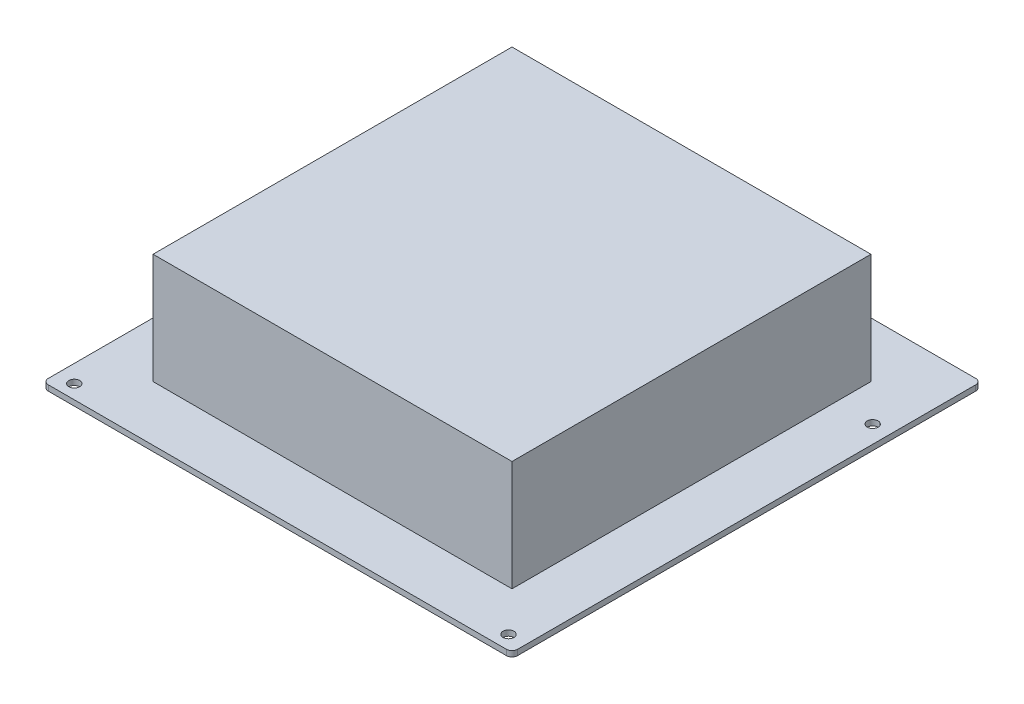
from build123d import *

# Parameters (mm, degrees)
SKETCH1_W           = 170.18
SKETCH1_H           = 170.18
BOSS_EXTRUDE1_DEPTH = 2
FILLET1_R           = 2
SKETCH3_R           = 1.975
CUT_EXTRUDE1_DEPTH  = 121.352051083
SKETCH4_W           = 130.18
SKETCH4_H           = 130.18
BOSS_EXTRUDE2_DEPTH = 40


with BuildPart() as part:
    # Sketch1 → Boss-Extrude1 (new body)
    with BuildSketch(Plane(origin=(0, 0, 0), x_dir=(1, 0, 0), z_dir=(0, 1, 0))):
        Rectangle(SKETCH1_W, SKETCH1_H)
    extrude(amount=BOSS_EXTRUDE1_DEPTH)

    # Fillet1
    fillet1_edges = [part.edges().sort_by_distance(p)[0] for p in [
        (-85.09, 1, -85.09),
        (85.09, 1, -85.09),
        (85.09, 1, 85.09),
        (-85.09, 1, 85.09),
    ]]
    fillet(fillet1_edges, radius=FILLET1_R)

    # Sketch3 → Cut-Extrude1 (cut, through all)
    with BuildSketch(Plane(origin=(0, 2, 0), x_dir=(1, 0, 0), z_dir=(0, 1, 0))):
        with Locations((-78.74, 71.321596211)):
            Circle(SKETCH3_R)
        with Locations((78.74, 52.07)):
            Circle(SKETCH3_R)
        with Locations((78.74, -80.01)):
            Circle(SKETCH3_R)
        with Locations((-78.74, -80.01)):
            Circle(SKETCH3_R)
    extrude(amount=-CUT_EXTRUDE1_DEPTH, mode=Mode.SUBTRACT)

    # Sketch4 → Boss-Extrude2 (add)
    with BuildSketch(Plane(origin=(0, 2, 0), x_dir=(1, 0, 0), z_dir=(0, 1, 0))):
        Rectangle(SKETCH4_W, SKETCH4_H)
    extrude(amount=BOSS_EXTRUDE2_DEPTH)


solid = part.part
